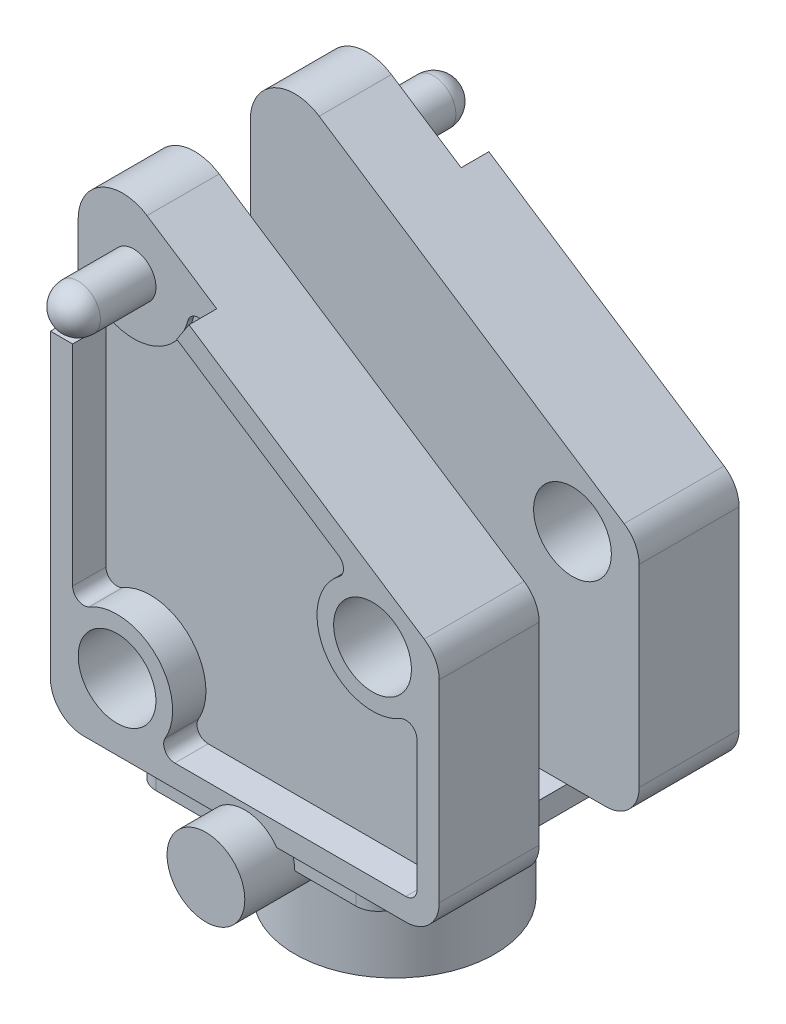
from build123d import *

# Parameters (mm, degrees)
BOSS_EXTRUDE1_DEPTH            = 22
SKETCH2_W                      = 35
SKETCH2_H                      = 22
BOSS_EXTRUDE2_DEPTH            = 24
BOSS_EXTRUDE3_DEPTH            = 1.5
BOSS_EXTRUDE4_START            = 2.5
BOSS_EXTRUDE4_DEPTH            = 2.5
CUT_EXTRUDE1_DEPTH             = 9
SKETCH6_W                      = 35
SKETCH6_H                      = 1
CUT_EXTRUDE2_DEPTH             = 2
SKETCH7_W                      = 2
SKETCH7_H                      = 1.5
CUT_EXTRUDE3_DEPTH             = 7.510590912
SKETCH8_W                      = 1.5
SKETCH8_H                      = 2
CUT_EXTRUDE4_DEPTH             = 7.510590912
SKETCH9_W                      = 2
SKETCH9_H                      = 2.5
CUT_EXTRUDE5_DEPTH             = 7.510590912
SKETCH10_W                     = 2.5
SKETCH10_H                     = 2
CUT_EXTRUDE6_DEPTH             = 7.510590912
CUT_EXTRUDE7_DEPTH             = 6.5
CUT_EXTRUDE8_DEPTH             = 6.5
BOSS_EXTRUDE5_DEPTH            = 1
CUT_EXTRUDE9_DEPTH             = 0.5
CUT_EXTRUDE10_START            = -0.5
CUT_EXTRUDE10_DEPTH            = 0.5
SKETCH16_R                     = 9
BOSS_EXTRUDE6_DEPTH            = 10
F_17_0_17_DIAMETER_HOLE1_D     = 17
F_17_0_17_DIAMETER_HOLE1_DEPTH = 10
BOSS_EXTRUDE7_REACH            = 61.982
BOSS_EXTRUDE7_END_RADIUS       = 8.5
SKETCH22_W                     = 3.5
SKETCH22_H                     = 8.708438024
F_7_0_7_DIAMETER_HOLE1_D       = 7
F_7_0_7_DIAMETER_HOLE1_DEPTH   = 9
F_7_0_7_DIAMETER_HOLE2_D       = 7
F_7_0_7_DIAMETER_HOLE2_DEPTH   = 13.5
FILLET1_R                      = 1
FILLET2_R                      = 2
FILLET3_R                      = 3


# Read off the part's stored shape, not the designer's step: Boss-Extrude8, Boss-Extrude9
with BuildPart() as part:
    # Sketch1 → Boss-Extrude1 (new body)
    with BuildSketch(Plane.XY.offset(11)):
        with BuildLine():
            Line((-17.5, 34), (17.5, 34))
            Line((17.5, 34), (-11.303288453, 52.927875269))
            ThreePointArc((-11.303288453, 52.927875269), (-15.399098972, 53.105482741), (-17.5, 49.585053351))
            Line((-17.5, 49.585053351), (-17.5, 34))
        make_face()
    extrude(amount=-BOSS_EXTRUDE1_DEPTH)

    # Sketch2 → Boss-Extrude2 (add)
    with BuildSketch(Plane.XZ.offset(-34)):
        Rectangle(SKETCH2_W, SKETCH2_H)
    extrude(amount=BOSS_EXTRUDE2_DEPTH)

    # Sketch3 → Boss-Extrude3 (add)
    with BuildSketch(Plane.XY.offset(11)):
        with BuildLine():
            Line((17.5, 10), (-17.5, 10))
            Line((-17.5, 10), (-17.5, 49.585053351))
            Line((-17.5, 49.585053351), (-15.5, 49.585053351))
            Line((-15.5, 49.585053351), (-15.5, 23.196152423))
            ThreePointArc((-15.5, 23.196152423), (-15, 22.330127019), (-14, 22.330127019))
            ThreePointArc((-14, 22.330127019), (-7.964466094, 21.535533906), (-7.169872981, 15.5))
            ThreePointArc((-7.169872981, 15.5), (-7.169872981, 14.5), (-6.303847577, 14))
            Line((-6.303847577, 14), (15.5, 14))
            Line((15.5, 14), (15.5, 26.74670472))
            ThreePointArc((15.5, 26.74670472), (15, 27.612730124), (14, 27.612730124))
            ThreePointArc((14, 27.612730124), (7.332352094, 29.180482995), (8.485775207, 35.932148922))
            ThreePointArc((8.485775207, 35.932148922), (8.882391034, 36.762842318), (8.432108136, 37.565712758))
            Line((8.432108136, 37.565712758), (-12.401644227, 51.25646431))
            Line((-12.401644227, 51.25646431), (-11.303288453, 52.927875269))
            Line((-11.303288453, 52.927875269), (17.5, 34))
            Line((17.5, 34), (17.5, 10))
        make_face()
    extrude(amount=BOSS_EXTRUDE3_DEPTH)

    # Sketch4 → Boss-Extrude4 (add)
    with BuildSketch(Plane(origin=(0, 0, -11), x_dir=(-1, 0, 0), z_dir=(0, 0, -1)).offset(BOSS_EXTRUDE4_START)):
        with BuildLine():
            Line((12.401644227, 51.25646431), (-8.432108136, 37.565712758))
            ThreePointArc((-8.432108136, 37.565712758), (-8.882391034, 36.762842318), (-8.485775207, 35.932148922))
            ThreePointArc((-8.485775207, 35.932148922), (-7.332352094, 29.180482995), (-14, 27.612730124))
            ThreePointArc((-14, 27.612730124), (-15, 27.612730124), (-15.5, 26.74670472))
            Line((-15.5, 26.74670472), (-15.5, 14))
            Line((-15.5, 14), (6.303847577, 14))
            ThreePointArc((6.303847577, 14), (7.169872981, 14.5), (7.169872981, 15.5))
            ThreePointArc((7.169872981, 15.5), (7.964466094, 21.535533906), (14, 22.330127019))
            ThreePointArc((14, 22.330127019), (15, 22.330127019), (15.5, 23.196152423))
            Line((15.5, 23.196152423), (15.5, 49.585053351))
            Line((15.5, 49.585053351), (17.5, 49.585053351))
            Line((17.5, 49.585053351), (17.5, 10))
            Line((17.5, 10), (-17.5, 10))
            Line((-17.5, 10), (-17.5, 34))
            Line((-17.5, 34), (11.303288453, 52.927875269))
            Line((11.303288453, 52.927875269), (12.401644227, 51.25646431))
        make_face()
    extrude(amount=-BOSS_EXTRUDE4_DEPTH)

    # Sketch5 → Cut-Extrude1 (cut)
    with BuildSketch(Plane.XY.offset(4.5)):
        with BuildLine():
            Line((-17.5, 49.585053351), (-17.5, 12))
            Line((-17.5, 12), (17.5, 12))
            Line((17.5, 12), (17.5, 34))
            Line((17.5, 34), (-11.303288453, 52.927875269))
            ThreePointArc((-11.303288453, 52.927875269), (-15.399098972, 53.105482741), (-17.5, 49.585053351))
        make_face()
    extrude(amount=-CUT_EXTRUDE1_DEPTH, mode=Mode.SUBTRACT)

    # Sketch6 → Cut-Extrude2 (cut)
    with BuildSketch(Plane.XZ.offset(-10)):
        with Locations((0, -13)):
            Rectangle(SKETCH6_W, SKETCH6_H)
    extrude(amount=-CUT_EXTRUDE2_DEPTH, mode=Mode.SUBTRACT)

    # Sketch7 → Cut-Extrude3 (cut)
    with BuildSketch(Plane(origin=(0, 49.585053351, 0), x_dir=(-1, 0, 0), z_dir=(0, 1, 0))):
        with Locations((16.5, 11.75)):
            Rectangle(SKETCH7_W, SKETCH7_H)
    extrude(amount=-CUT_EXTRUDE3_DEPTH, mode=Mode.SUBTRACT)

    # Sketch8 → Cut-Extrude4 (cut)
    with BuildSketch(Plane(origin=(-32.185557553, 21.150509249, 0), x_dir=(0, 0, 1), z_dir=(-0.8357054797012744, 0.5491778866608367, 0))):
        with Locations((11.75, 37.024599326)):
            Rectangle(SKETCH8_W, SKETCH8_H)
    extrude(amount=-CUT_EXTRUDE4_DEPTH, mode=Mode.SUBTRACT)

    # Sketch9 → Cut-Extrude5 (cut)
    with BuildSketch(Plane(origin=(0, 49.585053351, 0), x_dir=(-1, 0, 0), z_dir=(0, 1, 0))):
        with Locations((16.5, -12.25)):
            Rectangle(SKETCH9_W, SKETCH9_H)
    extrude(amount=-CUT_EXTRUDE5_DEPTH, mode=Mode.SUBTRACT)

    # Sketch10 → Cut-Extrude6 (cut)
    with BuildSketch(Plane(origin=(-32.185557553, 21.150509249, 0), x_dir=(0, 0, 1), z_dir=(-0.8357054797012744, 0.5491778866608367, 0))):
        with Locations((-12.25, 37.024599326)):
            Rectangle(SKETCH10_W, SKETCH10_H)
    extrude(amount=-CUT_EXTRUDE6_DEPTH, mode=Mode.SUBTRACT)

    # Sketch11 → Cut-Extrude7 (cut)
    with BuildSketch(Plane(origin=(17.5, 0, 0), x_dir=(0, 0, -1), z_dir=(1, 0, 0))):
        Polygon((-12.5, 10), (12.5, 10), (12.5, 12), (4.5, 12), (-4.5, 12), (-12.5, 12), align=None)
    extrude(amount=-CUT_EXTRUDE7_DEPTH, mode=Mode.SUBTRACT)

    # Sketch12 → Cut-Extrude8 (cut)
    with BuildSketch(Plane.ZY.offset(17.5)):
        Polygon((-4.5, 12), (-12.5, 12), (-12.5, 10), (12.5, 10), (12.5, 12), (4.5, 12), align=None)
    extrude(amount=-CUT_EXTRUDE8_DEPTH, mode=Mode.SUBTRACT)

    # Sketch13 → Boss-Extrude5 (add)
    with BuildSketch(Plane.XY.offset(12.5)):
        with BuildLine():
            Line((17.5, 12), (-17.5, 12))
            Line((-17.5, 12), (-17.5, 42.074462439))
            Line((-17.5, 42.074462439), (-15.5, 42.074462439))
            Line((-15.5, 42.074462439), (-15.5, 23.196152423))
            ThreePointArc((-15.5, 23.196152423), (-15, 22.330127019), (-14, 22.330127019))
            ThreePointArc((-14, 22.330127019), (-7.964466094, 21.535533906), (-7.169872981, 15.5))
            ThreePointArc((-7.169872981, 15.5), (-7.169872981, 14.5), (-6.303847577, 14))
            Line((-6.303847577, 14), (15.5, 14))
            Line((15.5, 14), (15.5, 26.74670472))
            ThreePointArc((15.5, 26.74670472), (15, 27.612730124), (14, 27.612730124))
            ThreePointArc((14, 27.612730124), (7.332352094, 29.180482995), (8.485775207, 35.932148922))
            ThreePointArc((8.485775207, 35.932148922), (8.882391034, 36.762842318), (8.432108136, 37.565712758))
            Line((8.432108136, 37.565712758), (-6.125002246, 47.131813865))
            Line((-6.125002246, 47.131813865), (-5.026646473, 48.803224825))
            Line((-5.026646473, 48.803224825), (17.5, 34))
            Line((17.5, 34), (17.5, 12))
        make_face()
    extrude(amount=BOSS_EXTRUDE5_DEPTH)

    # Sketch14 → Cut-Extrude9 (cut)
    with BuildSketch(Plane(origin=(0, 0, -11), x_dir=(-1, 0, 0), z_dir=(0, 0, -1))):
        with BuildLine():
            Line((6.125002246, 47.131813865), (-8.432108136, 37.565712758))
            ThreePointArc((-8.432108136, 37.565712758), (-8.882391034, 36.762842318), (-8.485775207, 35.932148922))
            ThreePointArc((-8.485775207, 35.932148922), (-7.332352094, 29.180482995), (-14, 27.612730124))
            ThreePointArc((-14, 27.612730124), (-15, 27.612730124), (-15.5, 26.74670472))
            Line((-15.5, 26.74670472), (-15.5, 14))
            Line((-15.5, 14), (6.303847577, 14))
            ThreePointArc((6.303847577, 14), (7.169872981, 14.5), (7.169872981, 15.5))
            ThreePointArc((7.169872981, 15.5), (7.964466094, 21.535533906), (14, 22.330127019))
            ThreePointArc((14, 22.330127019), (15, 22.330127019), (15.5, 23.196152423))
            Line((15.5, 23.196152423), (15.5, 42.074462439))
            ThreePointArc((15.5, 42.074462439), (15.077350269, 42.89095902), (14.166666667, 43.01727148))
            ThreePointArc((14.166666667, 43.01727148), (10.126126285, 43.33077995), (7.64515011, 46.535309769))
            ThreePointArc((7.64515011, 46.535309769), (7.039462799, 47.227005036), (6.125002246, 47.131813865))
        make_face()
    extrude(amount=-CUT_EXTRUDE9_DEPTH, mode=Mode.SUBTRACT)

    # Sketch15 → Cut-Extrude10 (cut)
    with BuildSketch(Plane.XY.offset(11).offset(CUT_EXTRUDE10_START)):
        with BuildLine():
            Line((-15.5, 42.074462439), (-15.5, 23.196152423))
            ThreePointArc((-15.5, 23.196152423), (-15, 22.330127019), (-14, 22.330127019))
            ThreePointArc((-14, 22.330127019), (-7.964466094, 21.535533906), (-7.169872981, 15.5))
            ThreePointArc((-7.169872981, 15.5), (-7.169872981, 14.5), (-6.303847577, 14))
            Line((-6.303847577, 14), (15.5, 14))
            Line((15.5, 14), (15.5, 26.74670472))
            ThreePointArc((15.5, 26.74670472), (15, 27.612730124), (14, 27.612730124))
            ThreePointArc((14, 27.612730124), (7.332352094, 29.180482995), (8.485775207, 35.932148922))
            ThreePointArc((8.485775207, 35.932148922), (8.882391034, 36.762842318), (8.432108136, 37.565712758))
            Line((8.432108136, 37.565712758), (-6.125002246, 47.131813865))
            ThreePointArc((-6.125002246, 47.131813865), (-7.039462799, 47.227005036), (-7.64515011, 46.535309769))
            ThreePointArc((-7.64515011, 46.535309769), (-10.126126285, 43.33077995), (-14.166666667, 43.01727148))
            ThreePointArc((-14.166666667, 43.01727148), (-15.077350269, 42.89095902), (-15.5, 42.074462439))
        make_face()
    extrude(amount=CUT_EXTRUDE10_DEPTH, mode=Mode.SUBTRACT)

    # Sketch16 → Boss-Extrude6 (add)
    with BuildSketch(Plane.XZ.offset(-10)):
        with Locations(Location((0, 0, 0), (0, 0, 270))):
            Circle(SKETCH16_R)
    extrude(amount=BOSS_EXTRUDE6_DEPTH)

    # Ø17.0 (17) Diameter Hole1
    with Locations(Plane(origin=(0, 0, 0), x_dir=(-1, 0, 0), z_dir=(0, -1, 0))):
        with Locations((0, 0)):
            Hole(F_17_0_17_DIAMETER_HOLE1_D / 2, depth=F_17_0_17_DIAMETER_HOLE1_DEPTH)

    # Boss-Extrude7: up to this cylinder (the profile starts inside it)
    boss_extrude7_end = Plane(origin=(0, 8.514554, 0), z_dir=(0, -1, 0)) * Cylinder(BOSS_EXTRUDE7_END_RADIUS, 141.964, mode=Mode.PRIVATE)
    # Sketch19 → Boss-Extrude7 (add, up to the surface)
    with BuildSketch(Plane(origin=(0, 0, 7), x_dir=(-1, 0, 0), z_dir=(0, 0, -1)), mode=Mode.PRIVATE) as boss_extrude7_sk1:
        with BuildLine():
            Line((3.5, 10), (-3.5, 10))
            ThreePointArc((-3.5, 10), (0, 6.5), (3.5, 10))
        make_face()
    boss_extrude7_tool1 = extrude(boss_extrude7_sk1.sketch, amount=-BOSS_EXTRUDE7_REACH, mode=Mode.PRIVATE) & boss_extrude7_end
    add(boss_extrude7_tool1.solids().sort_by_distance((0, 8.514554, 7))[0])

    # Boss-Extrude8 outline → Boss-Extrude8 (revolve)
    with BuildSketch(Plane(origin=(-12.5, 47.731316688, 0), x_dir=(1, 0, 0), z_dir=(0, -1, 0))):
        with BuildLine():
            ThreePointArc((0, -18), (1.414213563, -17.414213562), (2, -15.999999998))
            Line((2, -15.999999998), (2, -11))
            Line((2, -11), (0, -11))
            Line((0, -11), (0, -18))
        make_face()
    revolve(axis=Axis((-12.5, 47.731316688, 0), (0, 0, 1)))

    # Boss-Extrude9 outline → Boss-Extrude9 (revolve)
    with BuildSketch(Plane(origin=(-12.5, 47.731316688, 0), x_dir=(1, 0, 0), z_dir=(0, -1, 0))):
        with BuildLine():
            Line((2, 11), (2, 15.999999998))
            ThreePointArc((2, 15.999999998), (1.414213563, 17.414213562), (0, 18))
            Line((0, 18), (0, 11))
            Line((0, 11), (2, 11))
        make_face()
    revolve(axis=Axis((-12.5, 47.731316688, 0), (0, 0, 1)))

    # Sketch22 → Revolve1 (revolve)
    with BuildSketch(Plane(origin=(0, 10, 0), x_dir=(1, 0, 0), z_dir=(0, 1, 0))):
        with Locations((1.75, -12.645780988)):
            Rectangle(SKETCH22_W, SKETCH22_H)
    revolve(axis=Axis((0, 10, 8.291561976), (0, 0, 1)))

    # Ø7.0 (7) Diameter Hole1
    with Locations(Plane.XY.offset(13.5)):
        with Locations((-11.5, 18), (11.5, 31.942857143)):
            Hole(F_7_0_7_DIAMETER_HOLE1_D / 2, depth=F_7_0_7_DIAMETER_HOLE1_DEPTH)

    # Ø7.0 (7) Diameter Hole2
    with Locations(Plane.XY.offset(-4.5)):
        with Locations((-11.5, 18), (11.5, 31.942857143)):
            Hole(F_7_0_7_DIAMETER_HOLE2_D / 2, depth=F_7_0_7_DIAMETER_HOLE2_DEPTH)

    # Fillet1
    fillet1_edges = [part.edges().sort_by_distance(p)[0] for p in [
        (15.5, 14, 12),
        (15.5, 14, -12),
    ]]
    fillet(fillet1_edges, radius=FILLET1_R)

    # Fillet2
    fillet2_edges = [part.edges().sort_by_distance(p)[0] for p in [
        (11, 11, 12.5),
        (11, 11, -12.5),
        (-11, 11, 12.5),
        (-11, 11, -12.5),
    ]]
    fillet(fillet2_edges, radius=FILLET2_R)

    # Fillet3
    fillet3_edges = [part.edges().sort_by_distance(p)[0] for p in [
        (17.5, 34, 9),
        (-17.5, 12, -9),
        (17.5, 12, -9),
        (17.5, 12, 9),
        (-17.5, 12, 9),
        (17.5, 34, -9),
    ]]
    fillet(fillet3_edges, radius=FILLET3_R)


solid = part.part
